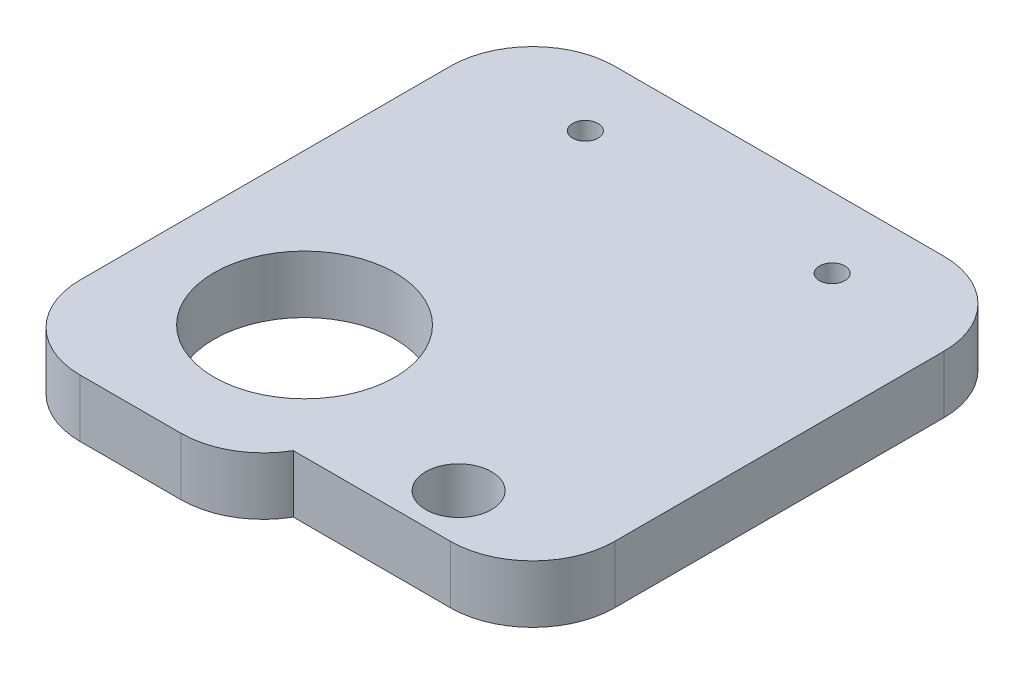
from build123d import *

# Parameters (mm, degrees)
SKETCH_1_W          = 60
SKETCH_1_H          = 60
EXTRUDE_1_DEPTH     = 7
SKETCH_2_R          = 4
SKETCH_2_R_2        = 11
CUT_EXTRUDE_1_DEPTH = 64.990752506
SKETCH_3_R          = 1.55
CUT_EXTRUDE_2_DEPTH = 64.990752506
FILLET_2_R          = 10
SKETCH_4_W          = 30.91835897
SKETCH_4_H          = 7
EXTRUDE_2_DEPTH     = 5
FILLET_3_R          = 10


with BuildPart() as part:
    # 草图1 → 凸台-拉伸1 (new body)
    with BuildSketch(Plane(origin=(0, 0, 0), x_dir=(1, 0, 0), z_dir=(0, 1, 0))):
        with Locations((4.5, -23.4375)):
            Rectangle(SKETCH_1_W, SKETCH_1_H)
    extrude(amount=EXTRUDE_1_DEPTH)

    # 草图2 → 切除-拉伸1 (cut, through all)
    with BuildSketch(Plane.XZ):
        with Locations(Location((19.679947821, 47.605596436, 0), (0, 0, 270))):
            Circle(SKETCH_2_R)
        with Locations(Location((-7.128568068, 39.524539832, 0), (0, 0, 270))):
            Circle(SKETCH_2_R_2)
    extrude(amount=-CUT_EXTRUDE_1_DEPTH, mode=Mode.SUBTRACT)

    # 草图3 → 切除-拉伸2 (cut, through all)
    with BuildSketch(Plane.XZ):
        with Locations(Location((-10.5, 2.024539832, 0), (0, 0, 270))):
            Circle(SKETCH_3_R)
        with Locations(Location((19.5, 2.024539832, 0), (0, 0, 270))):
            Circle(SKETCH_3_R)
    extrude(amount=-CUT_EXTRUDE_2_DEPTH, mode=Mode.SUBTRACT)

    # 圆角2
    fillet_2_edges = [part.edges().sort_by_distance(p)[0] for p in [
        (-25.5, 3.5, -6.5625),
        (34.5, 3.5, -6.5625),
        (34.5, 3.5, 53.4375),
    ]]
    fillet(fillet_2_edges, radius=FILLET_2_R)

    # 草图4 → 凸台-拉伸2 (add)
    with BuildSketch(Plane.XY.offset(53.4375)):
        with Locations((-10.040820515, 3.5)):
            Rectangle(SKETCH_4_W, SKETCH_4_H)
    extrude(amount=EXTRUDE_2_DEPTH)

    # 圆角3
    # the kernel refuses this fillet: 10 mm, written as the material it takes off along each edge
    with BuildSketch(Plane(origin=(5.41835897, -21.650635095, 58.4375), x_dir=(-1, 0, 0), z_dir=(0, 1, 0))) as fillet_3_piece_1:
        with BuildLine():
            CenterArc((8.660254038, -10), FILLET_3_R, 90, 60)
            Line((0, -5), (-0.173205081, -4.9))
            ThreePointArc((-0.173205081, -4.9), (-0.2, -2.5), (-0.2, 0))
            Line((-0.2, 0), (0, 0.2))
            Line((0, 0.2), (8.660254038, 0.2))
            Line((8.660254038, 0.2), (8.660254038, 0))
        make_face()
    extrude(amount=50.301270189, mode=Mode.SUBTRACT)
    with BuildSketch(Plane(origin=(-25.5, 32, 58.4375), x_dir=(0, 0, -1), z_dir=(0, -1, 0))) as fillet_3_piece_2:
        with BuildLine():
            CenterArc((FILLET_3_R, FILLET_3_R), FILLET_3_R, 180, 90)
            Line((0, FILLET_3_R), (-FILLET_3_R * 0.02, FILLET_3_R))
            Line((-FILLET_3_R * 0.02, FILLET_3_R), (-FILLET_3_R * 0.02, -FILLET_3_R * 0.02))
            Line((-FILLET_3_R * 0.02, -FILLET_3_R * 0.02), (FILLET_3_R, -FILLET_3_R * 0.02))
            Line((FILLET_3_R, -FILLET_3_R * 0.02), (FILLET_3_R, 0))
        make_face()
    extrude(amount=57, mode=Mode.SUBTRACT)


solid = part.part
